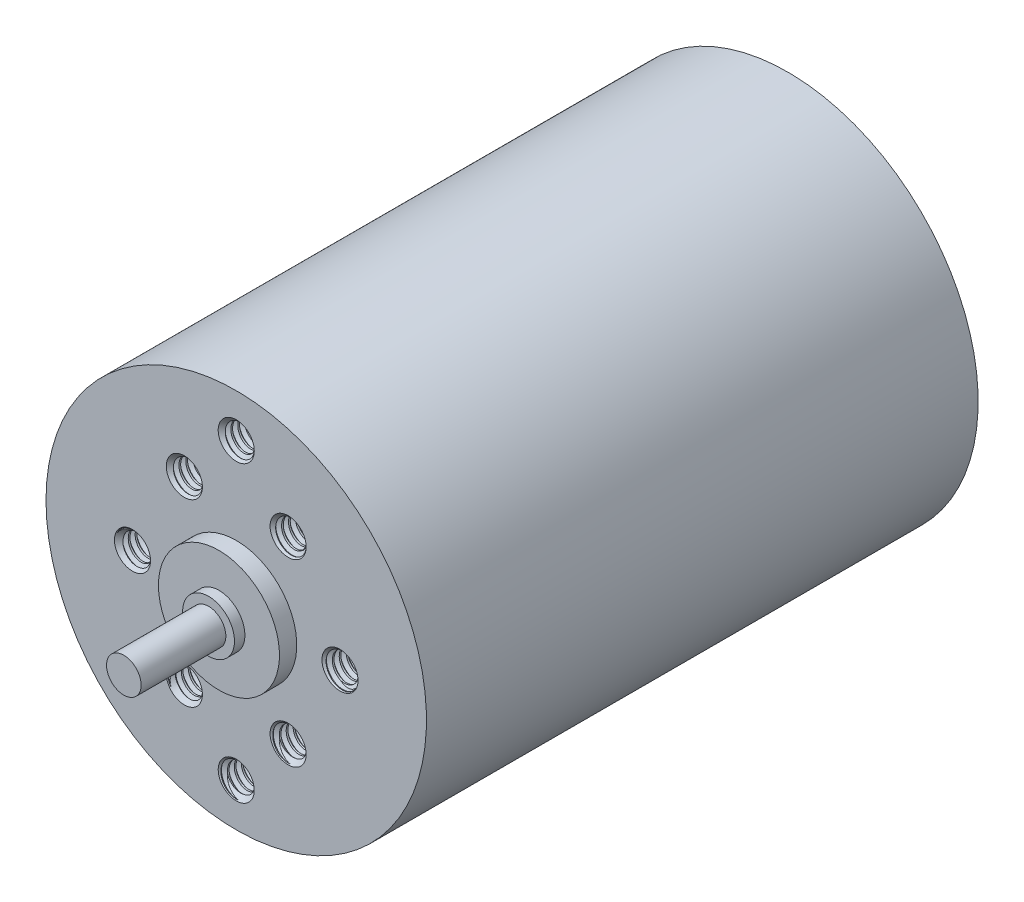
from build123d import *

# Parameters (mm, degrees)
SKETCH4_R          = 1
CUT_EXTRUDE1_DEPTH = 2.9
SWEEP1_PITCH       = 0.4
CIRPATTERN1_COUNT  = 2
SKETCH10_R         = 1
CUT_EXTRUDE4_DEPTH = 4.4
SWEEP2_PITCH       = 0.4
CIRPATTERN2_COUNT  = 6


with BuildPart() as part:
    # Sketch3 → Revolve1 (revolve)
    with BuildSketch(Plane(origin=(0, 0, 0), x_dir=(0, 0, -1), z_dir=(1, 0, 0)), mode=Mode.PRIVATE) as revolve1_sk:
        Polygon((38.4, 0), (38.4, 11), (6.5, 11), (6.5, 3.5), (5.5, 3.5), (5.5, 1.5), (4.9, 1.5), (4.9, 1), (0, 1), (0, 0), align=None)
    revolve(revolve1_sk.sketch.rotate(Axis((0, 0, -38.4), (0, 0, 1)), 90), axis=Axis((0, 0, -38.4), (0, 0, 1)))

    # Sketch4 → Cut-Extrude1 (cut)
    with BuildSketch(Plane.XY.offset(-6.5)):
        with Locations((0, 8.5)):
            Circle(SKETCH4_R)
    cut_extrude1 = extrude(amount=-CUT_EXTRUDE1_DEPTH, mode=Mode.SUBTRACT)

    # Sweep1: arcs per turn and ends read off the stored shape
    # Sweep1: the profile of Sketch6 screwed along a right-hand helix through 8.25 turns, 6 arcs to a turn; built about Z, then put on its axis
    sweep1_z = Axis((0, 0, 0), (0, 0, 1))
    sweep1_corners = [(0.783493649, 0, -0.125), (0.783493649, 0, -0.225), (1.021650635, 0, -0.3625), (1.021650635, 0, 0.0125)]
    with BuildLine(mode=Mode.PRIVATE) as sweep1_profile:
        Line(sweep1_corners[0], sweep1_corners[1])
        Line(sweep1_corners[1], sweep1_corners[2])
        Line(sweep1_corners[2], sweep1_corners[3])
        Line(sweep1_corners[3], sweep1_corners[0])
    sweep1_cap = Face(sweep1_profile.wire())
    sweep1_turn_angles = [0, 30, 60, 90, 120, 150, 180, 210, 240, 270, 300, 330, 360]
    sweep1_turn_weights = [1, 0.8660254037844387, 1, 0.8660254037844387, 1, 0.8660254037844387, 1, 0.8660254037844387, 1, 0.8660254037844387, 1, 0.8660254037844387, 1]
    sweep1_turn_rails = [Edge.make_bspline([Vector(p[0], p[1], 0).rotate(sweep1_z, sweep1_turn_angles[k]) / sweep1_turn_weights[k] + Vector(0, 0, p[2] + SWEEP1_PITCH * sweep1_turn_angles[k] / 360) for k in range(13)], [0, 0, 0, 1, 1, 2, 2, 3, 3, 4, 4, 5, 5, 6, 6, 6], 2, sweep1_turn_weights) for p in sweep1_corners]
    sweep1_turn_sides = [Face.make_surface_from_curves(sweep1_turn_rails[p[0]], sweep1_turn_rails[p[1]]) for p in [(0, 1), (1, 2), (2, 3), (3, 0)]]
    sweep1_last_angles = [2880, 2910, 2940, 2955, 2970]
    sweep1_last_weights = [1, 0.8660254037844387, 1, 0.9659258262890364, 1]
    sweep1_last_rails = [Edge.make_bspline([Vector(p[0], p[1], 0).rotate(sweep1_z, sweep1_last_angles[k]) / sweep1_last_weights[k] + Vector(0, 0, p[2] + SWEEP1_PITCH * sweep1_last_angles[k] / 360) for k in range(5)], [0, 0, 0, 1, 1, 2, 2, 2], 2, sweep1_last_weights) for p in sweep1_corners]
    sweep1_last_sides = [Face.make_surface_from_curves(sweep1_last_rails[p[0]], sweep1_last_rails[p[1]]) for p in [(0, 1), (1, 2), (2, 3), (3, 0)]]
    sweep1 = Plane(origin=(0, 8.5, -6.5), x_dir=(0, 1, 0), z_dir=(0, 0, -1)) * Solid(Shell([*[p.moved(Location((0, 0, SWEEP1_PITCH * i))) for i in range(8) for p in sweep1_turn_sides], *sweep1_last_sides, sweep1_cap, sweep1_cap.rotate(sweep1_z, 2970).moved(Location((0, 0, SWEEP1_PITCH * 2970 / 360)))]))
    add(sweep1)

    # Cut-Extrude2: read off the stored shape, not the designer's step
    # Cut-Extrude2 outline → Cut-Extrude2 (revolve, cut)
    with BuildSketch(Plane.XZ.offset(-8.5)):
        Polygon((0.783490948, -6.759810322), (1.04330127, -6.5), (1.04330127, -6.1374999), (0.783490948, -6.1374999), align=None)
    cut_extrude2 = revolve(axis=Axis((0, 8.5, 0), (0, 0, 1)), mode=Mode.SUBTRACT)

    # CirPattern1: Cut-Extrude1, Sweep1, Cut-Extrude2 ×2 about axis
    cirpattern1_axis = Axis((0, 0, -38.4), (0, 0, -1))
    add([cut_extrude1.rotate(cirpattern1_axis, i * 360 / CIRPATTERN1_COUNT) for i in range(1, CIRPATTERN1_COUNT)], mode=Mode.SUBTRACT)
    add([sweep1.rotate(cirpattern1_axis, i * 360 / CIRPATTERN1_COUNT) for i in range(1, CIRPATTERN1_COUNT)])
    add([cut_extrude2.rotate(cirpattern1_axis, i * 360 / CIRPATTERN1_COUNT) for i in range(1, CIRPATTERN1_COUNT)], mode=Mode.SUBTRACT)

    # Sketch10 → Cut-Extrude4 (cut)
    with BuildSketch(Plane.XY.offset(-6.5)):
        with Locations((-3, 5.196152423)):
            Circle(SKETCH10_R)
    cut_extrude4 = extrude(amount=-CUT_EXTRUDE4_DEPTH, mode=Mode.SUBTRACT)

    # Sweep2: arcs per turn and ends read off the stored shape
    # Sweep2: the profile of Sketch12 screwed along a right-hand helix through 12 turns, 6 arcs to a turn; built about Z, then put on its axis
    sweep2_z = Axis((0, 0, 0), (0, 0, 1))
    sweep2_corners = [(0.783493649, 0, -0.125), (0.783493649, 0, -0.225), (1.021650635, 0, -0.3625), (1.021650635, 0, 0.0125)]
    with BuildLine(mode=Mode.PRIVATE) as sweep2_profile:
        Line(sweep2_corners[0], sweep2_corners[1])
        Line(sweep2_corners[1], sweep2_corners[2])
        Line(sweep2_corners[2], sweep2_corners[3])
        Line(sweep2_corners[3], sweep2_corners[0])
    sweep2_cap = Face(sweep2_profile.wire())
    sweep2_turn_angles = [0, 30, 60, 90, 120, 150, 180, 210, 240, 270, 300, 330, 360]
    sweep2_turn_weights = [1, 0.8660254037844387, 1, 0.8660254037844387, 1, 0.8660254037844387, 1, 0.8660254037844387, 1, 0.8660254037844387, 1, 0.8660254037844387, 1]
    sweep2_turn_rails = [Edge.make_bspline([Vector(p[0], p[1], 0).rotate(sweep2_z, sweep2_turn_angles[k]) / sweep2_turn_weights[k] + Vector(0, 0, p[2] + SWEEP2_PITCH * sweep2_turn_angles[k] / 360) for k in range(13)], [0, 0, 0, 1, 1, 2, 2, 3, 3, 4, 4, 5, 5, 6, 6, 6], 2, sweep2_turn_weights) for p in sweep2_corners]
    sweep2_turn_sides = [Face.make_surface_from_curves(sweep2_turn_rails[p[0]], sweep2_turn_rails[p[1]]) for p in [(0, 1), (1, 2), (2, 3), (3, 0)]]
    sweep2 = Plane(origin=(-3, 5.196152423, -6.5), x_dir=(0, 1, 0), z_dir=(0, 0, -1)) * Solid(Shell([*[p.moved(Location((0, 0, SWEEP2_PITCH * i))) for i in range(12) for p in sweep2_turn_sides], sweep2_cap, sweep2_cap.rotate(sweep2_z, 4320).moved(Location((0, 0, SWEEP2_PITCH * 4320 / 360)))]))
    add(sweep2)

    # Cut-Extrude5: read off the stored shape, not the designer's step
    # Cut-Extrude5 outline → Cut-Extrude5 (revolve, cut)
    with BuildSketch(Plane(origin=(-3, 5.196152423, 0), x_dir=(1, 0, 0), z_dir=(0, -1, 0))):
        Polygon((0.783490948, -6.759810322), (1.04330127, -6.5), (1.04330127, -6.1374999), (0.783490948, -6.1374999), align=None)
    cut_extrude5 = revolve(axis=Axis((-3, 5.196152423, 0), (0, 0, 1)), mode=Mode.SUBTRACT)

    # CirPattern2: Cut-Extrude4, Sweep2, Cut-Extrude5 ×6 about axis
    cirpattern2_axis = Axis((0, 0, -38.4), (0, 0, -1))
    add([cut_extrude4.rotate(cirpattern2_axis, i * 360 / CIRPATTERN2_COUNT) for i in range(1, CIRPATTERN2_COUNT)], mode=Mode.SUBTRACT)
    add([sweep2.rotate(cirpattern2_axis, i * 360 / CIRPATTERN2_COUNT) for i in range(1, CIRPATTERN2_COUNT)])
    add([cut_extrude5.rotate(cirpattern2_axis, i * 360 / CIRPATTERN2_COUNT) for i in range(1, CIRPATTERN2_COUNT)], mode=Mode.SUBTRACT)


solid = part.part
